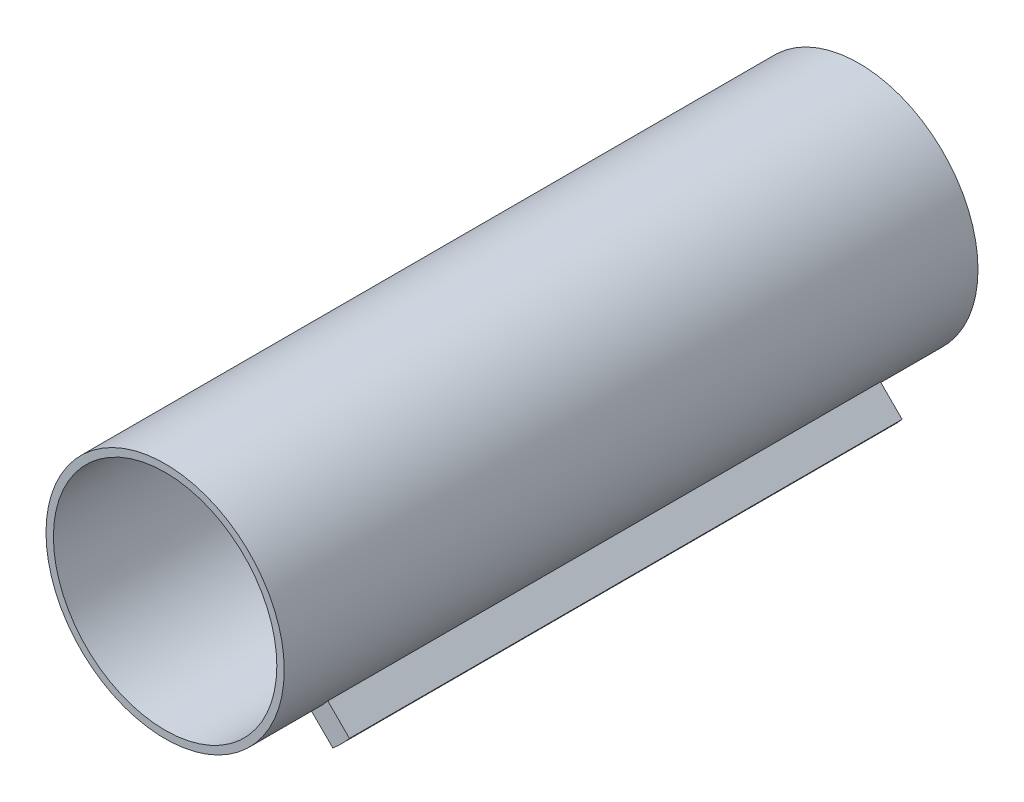
from build123d import *

# Parameters (mm, degrees)
SKETCH1_R           = 101.3
SKETCH1_R_2         = 95
BOSS_EXTRUDE1_DEPTH = 590
BOSS_EXTRUDE2_DEPTH = 470


with BuildPart() as part:
    # Sketch1 → Boss-Extrude1 (new body)
    with BuildSketch(Plane.XY):
        Circle(SKETCH1_R)
        Circle(SKETCH1_R_2, mode=Mode.SUBTRACT)
    extrude(amount=BOSS_EXTRUDE1_DEPTH)

    # Sketch6 → Boss-Extrude2 (add)
    with BuildSketch(Plane(origin=(0, 0, 60), x_dir=(-1, 0, 0), z_dir=(0, 0, -1))):
        with BuildLine():
            Line((96.772133859, -82.629998235), (78.351114108, -64.208978484))
            ThreePointArc((78.351114108, -64.208978484), (71.629916934, -71.629916934), (64.208978484, -78.351114108))
            Line((64.208978484, -78.351114108), (82.629998235, -96.772133859))
            ThreePointArc((82.629998235, -96.772133859), (89.979337906, -89.979337906), (96.772133859, -82.629998235))
        make_face()
    boss_extrude2 = extrude(amount=-BOSS_EXTRUDE2_DEPTH)

    # Mirror1: Boss-Extrude2 across plane
    add(boss_extrude2.mirror(Plane(origin=(0, 0, 0), x_dir=(0, 0, 1), z_dir=(1, 0, 0))))


solid = part.part
